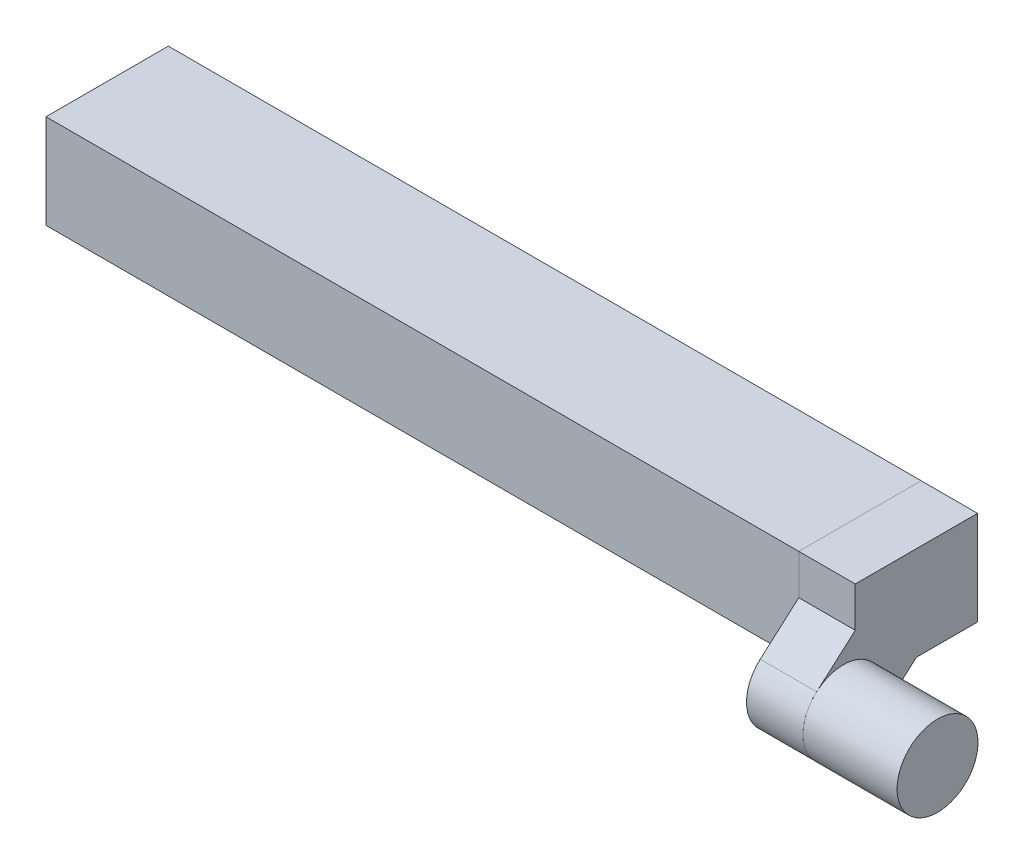
from build123d import *

# Parameters (mm, degrees)
SKETCH2_W           = 6.5
SKETCH2_H           = 5
SKETCH2_W_2         = 4.1
SKETCH2_H_2         = 4.1
BOSS_EXTRUDE1_DEPTH = 10
BOSS_EXTRUDE2_START = 15
SKETCH2_2_W         = 6.5
SKETCH2_2_H         = 5
BOSS_EXTRUDE2_DEPTH = 25
BOSS_EXTRUDE3_DEPTH = 3
SKETCH6_R           = 2.15
BOSS_EXTRUDE4_DEPTH = 5
BOSS_EXTRUDE5_START = 10
SKETCH2_4_W         = 6.5
SKETCH2_4_H         = 5
SKETCH2_4_W_2       = 4.1
SKETCH2_4_H_2       = 4.1
BOSS_EXTRUDE5_DEPTH = 5


with BuildPart() as part:
    # Sketch2 → Boss-Extrude1 (new body)
    with BuildSketch(Plane(origin=(0, 0, 0), x_dir=(0, 0, -1), z_dir=(1, 0, 0))):
        Rectangle(SKETCH2_W, SKETCH2_H)
        Rectangle(SKETCH2_W_2, SKETCH2_H_2, mode=Mode.SUBTRACT)
    extrude(amount=BOSS_EXTRUDE1_DEPTH)



with BuildPart() as body_2:
    # Sketch2<2> → Boss-Extrude2 (new body)
    with BuildSketch(Plane(origin=(0, 0, 0), x_dir=(0, 0, -1), z_dir=(1, 0, 0)).offset(BOSS_EXTRUDE2_START)):
        Rectangle(SKETCH2_2_W, SKETCH2_2_H)
    extrude(amount=BOSS_EXTRUDE2_DEPTH)


with BuildPart() as body_3:
    # Sketch5 → Boss-Extrude3 (new body)
    with BuildSketch(Plane(origin=(40, 0, 0), x_dir=(0, 0, -1), z_dir=(1, 0, 0))):
        with BuildLine():
            Line((-3.25, 2.5), (3.25, 2.5))
            Line((3.25, 2.5), (3.25, -2.5))
            Line((3.25, -2.5), (0, -2.5))
            Line((0, -2.5), (-2.456272549, -4.663966521))
            ThreePointArc((-2.456272549, -4.663966521), (-5.490764782, -4.471985032), (-5.298783293, -1.4374928))
            Line((-5.298783293, -1.4374928), (-3.25, 0.367477278))
            Line((-3.25, 0.367477278), (-3.25, 2.5))
        make_face()
    extrude(amount=BOSS_EXTRUDE3_DEPTH)


with BuildPart() as body_4:
    # Sketch6 → Boss-Extrude4 (new body)
    with BuildSketch(Plane(origin=(43, 0, 0), x_dir=(0, 0, -1), z_dir=(1, 0, 0))):
        with Locations((-3.877527921, -3.05072966)):
            Circle(SKETCH6_R)
    extrude(amount=BOSS_EXTRUDE4_DEPTH)


with BuildPart() as part_1:
    add(part.part)

    add(body_2.part)  # Boss-Extrude5 merges body 2
    # Sketch2<4> → Boss-Extrude5 (add)
    with BuildSketch(Plane(origin=(0, 0, 0), x_dir=(0, 0, -1), z_dir=(1, 0, 0)).offset(BOSS_EXTRUDE5_START)):
        Rectangle(SKETCH2_4_W, SKETCH2_4_H)
        Rectangle(SKETCH2_4_W_2, SKETCH2_4_H_2, mode=Mode.SUBTRACT)
    extrude(amount=BOSS_EXTRUDE5_DEPTH)


solid = Compound([body_3.part, body_4.part, part_1.part])
